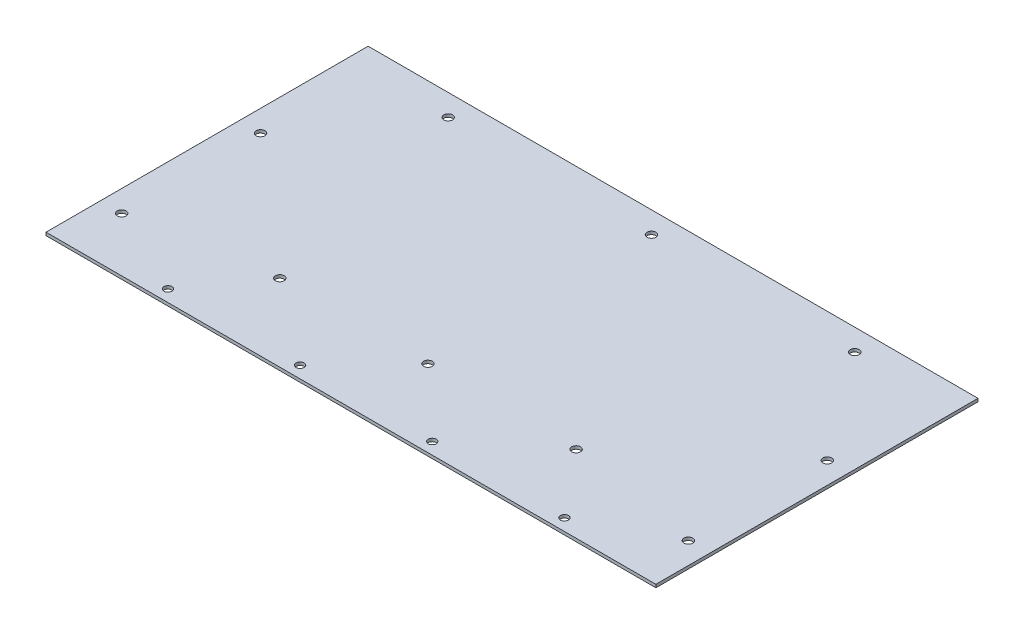
from build123d import *

# Parameters (mm, degrees)
SKETCH1_W            = 457.2
SKETCH1_H            = 2.286
BOSS_EXTRUDE1_DEPTH  = 238.315200026
SKETCH2_W            = 457.2
SKETCH2_H            = 2.286
BOSS_EXTRUDE2_DEPTH  = 3.175
SKETCH9_R            = 3
CUT_EXTRUDE10_DEPTH  = 2.54
LPATTERN1_COUNT      = 4
LPATTERN1_PITCH      = 99.06
M6_CLEARANCE_HOLE1_D = 6.6


with BuildPart() as part:
    # Sketch1 → Boss-Extrude1 (new body)
    with BuildSketch(Plane.XY):
        Rectangle(SKETCH1_W, SKETCH1_H)
    extrude(amount=BOSS_EXTRUDE1_DEPTH)

    # Sketch2 → Boss-Extrude2 (add)
    with BuildSketch(Plane(origin=(0, 0, 0), x_dir=(-1, 0, 0), z_dir=(0, 0, -1))):
        Rectangle(SKETCH2_W, SKETCH2_H)
    extrude(amount=BOSS_EXTRUDE2_DEPTH)

    # Sketch9 → Cut-Extrude10 (cut)
    with BuildSketch(Plane(origin=(0, 1.143, 0), x_dir=(1, 0, 0), z_dir=(0, 1, 0))):
        with Locations((-146.05, -229.425200026)):
            Circle(SKETCH9_R)
    cut_extrude10 = extrude(amount=-CUT_EXTRUDE10_DEPTH, mode=Mode.SUBTRACT)

    # LPattern1: Cut-Extrude10 ×4
    with Locations(*[(i * LPATTERN1_PITCH, 0, 0) for i in range(1, LPATTERN1_COUNT)]):
        add(cut_extrude10, mode=Mode.SUBTRACT)

    # M6 Clearance Hole1 (through all)
    with Locations(Plane.XZ.offset(1.143)):
        with Locations((-212.419, 93.644793717), (-152.4, 13.0175), (0, 13.0175), (152.4, 13.0175), (212.419, 93.644793717), (212.419, 197.784793717), (111.06649999, 180.586), (0, 180.586), (-111.06649999, 180.586), (-212.419, 197.784793717)):
            Hole(M6_CLEARANCE_HOLE1_D / 2)


solid = part.part
